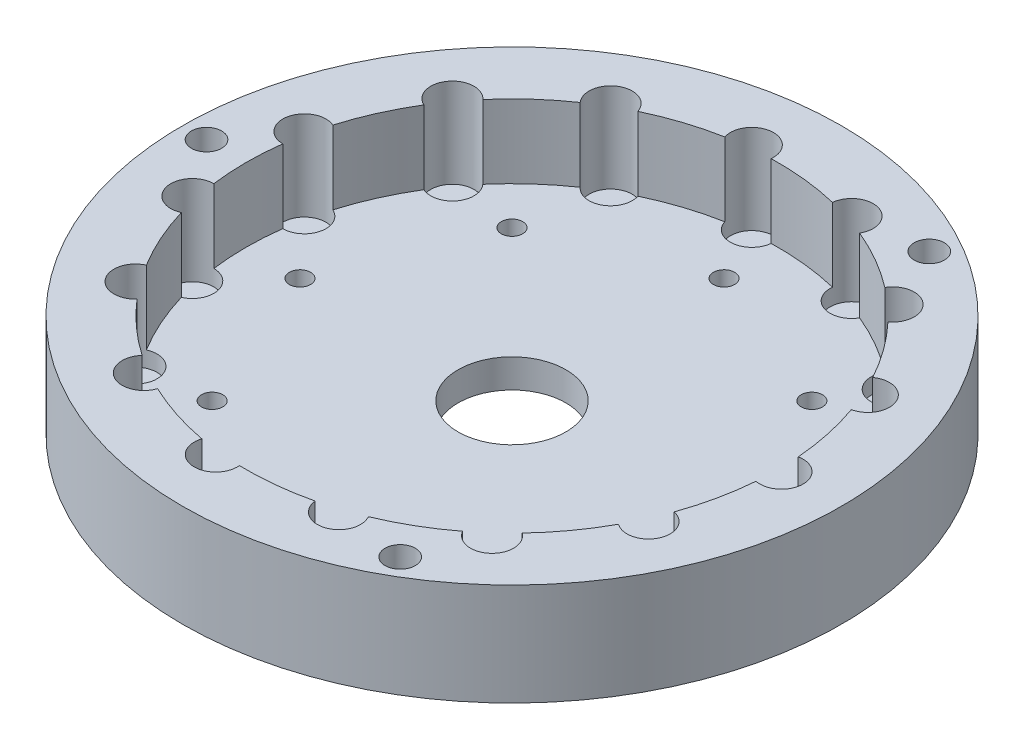
from build123d import *

# Parameters (mm, degrees)
SKETCH1_R           = 45.85
SKETCH1_R_2         = 2.1
SKETCH1_R_3         = 7.5
BOSS_EXTRUDE1_DEPTH = 4
SKETCH1_6_R         = 3
SKETCH1_6_R_2       = 1.48
CUT_EXTRUDE1_DEPTH  = 2.22
BOSS_EXTRUDE2_START = 10.22
SKETCH1_7_R         = 45.85
SKETCH1_7_R_2       = 2.1
BOSS_EXTRUDE2_DEPTH = 10.22


with BuildPart() as part:
    # Sketch1 → Boss-Extrude1 (new body)
    with BuildSketch(Plane(origin=(0, 0, 0), x_dir=(1, 0, 0), z_dir=(0, 1, 0))):
        Circle(SKETCH1_R)
        with Locations((-42.5, 0)):
            Circle(SKETCH1_R_2, mode=Mode.SUBTRACT)
        with Locations((21.25, -36.806079661)):
            Circle(SKETCH1_R_2, mode=Mode.SUBTRACT)
        with Locations((21.25, 36.806079661)):
            Circle(SKETCH1_R_2, mode=Mode.SUBTRACT)
        Circle(SKETCH1_R_3, mode=Mode.SUBTRACT)
    extrude(amount=-BOSS_EXTRUDE1_DEPTH)

    # Sketch1<6> → Cut-Extrude1 (cut)
    with BuildSketch(Plane(origin=(0, 0, 0), x_dir=(1, 0, 0), z_dir=(0, 1, 0))):
        with Locations((37.5, 0)):
            Circle(SKETCH1_6_R)
        with Locations((34.257954662, 15.252624115)):
            Circle(SKETCH1_6_R)
        with Locations((34.257954662, -15.252624115)):
            Circle(SKETCH1_6_R)
        with Locations((25.092397738, 27.867930955)):
            Circle(SKETCH1_6_R)
        with Locations((25.092397738, -27.867930955)):
            Circle(SKETCH1_6_R)
        with Locations((11.588137289, 35.664619361)):
            Circle(SKETCH1_6_R)
        with Locations((11.588137289, -35.664619361)):
            Circle(SKETCH1_6_R)
        with Locations((-3.919817373, 37.294571076)):
            Circle(SKETCH1_6_R)
        with Locations((-3.919817373, -37.294571076)):
            Circle(SKETCH1_6_R)
        with Locations((-18.75, 32.475952642)):
            Circle(SKETCH1_6_R)
        with Locations((-18.75, -32.475952642)):
            Circle(SKETCH1_6_R)
        with Locations((-30.338137289, 22.041946961)):
            Circle(SKETCH1_6_R)
        with Locations((-30.338137289, -22.041946961)):
            Circle(SKETCH1_6_R)
        with Locations((-36.680535028, 7.796688406)):
            Circle(SKETCH1_6_R)
        with Locations((-36.680535028, -7.796688406)):
            Circle(SKETCH1_6_R)
        with Locations((29.5, 0)):
            Circle(SKETCH1_6_R_2)
        with Locations((20.859650045, -20.859650045)):
            Circle(SKETCH1_6_R_2)
        with Locations((0, -29.5)):
            Circle(SKETCH1_6_R_2)
        with Locations((-20.859650045, -20.859650045)):
            Circle(SKETCH1_6_R_2)
        with Locations((-29.5, 0)):
            Circle(SKETCH1_6_R_2)
        with Locations((-20.859650045, 20.859650045)):
            Circle(SKETCH1_6_R_2)
        with Locations((0, 29.5)):
            Circle(SKETCH1_6_R_2)
        with Locations((20.859650045, 20.859650045)):
            Circle(SKETCH1_6_R_2)
    extrude(amount=-CUT_EXTRUDE1_DEPTH, mode=Mode.SUBTRACT)

    # Sketch1<7> → Boss-Extrude2 (add)
    with BuildSketch(Plane(origin=(0, 0, 0), x_dir=(1, 0, 0), z_dir=(0, 1, 0)).offset(BOSS_EXTRUDE2_START)):
        Circle(SKETCH1_7_R)
        with Locations((-42.5, 0)):
            Circle(SKETCH1_7_R_2, mode=Mode.SUBTRACT)
        with Locations((21.25, -36.806079661)):
            Circle(SKETCH1_7_R_2, mode=Mode.SUBTRACT)
        with BuildLine():
            ThreePointArc((36.883333333, 2.935936345), (39.39076704, 2.32916294), (40.5, 0))
            ThreePointArc((40.5, 0), (39.39076704, -2.32916294), (36.883333333, -2.935936345))
            ThreePointArc((36.883333333, -2.935936345), (36.191461227, -7.69273256), (34.888754523, -12.319691873))
            ThreePointArc((34.888754523, -12.319691873), (36.59166411, -13.367471546), (37.257954662, -15.252624115))
            ThreePointArc((37.257954662, -15.252624115), (35.6231437, -17.924001829), (32.500448736, -17.683914497))
            ThreePointArc((32.500448736, -17.683914497), (29.933628792, -21.748054335), (26.861593101, -25.445133446))
            ThreePointArc((26.861593101, -25.445133446), (27.767055295, -26.50917897), (28.092397738, -27.867930955))
            ThreePointArc((28.092397738, -27.867930955), (25.872343464, -30.764771418), (22.497941295, -29.37418318))
            ThreePointArc((22.497941295, -29.37418318), (18.5, -32.04293994), (14.189818202, -34.170880284))
            ThreePointArc((14.189818202, -34.170880284), (14.486847583, -34.891651942), (14.588137289, -35.664619361))
            ThreePointArc((14.588137289, -35.664619361), (11.748752331, -38.660316744), (8.605335417, -35.985388734))
            ThreePointArc((8.605335417, -35.985388734), (3.867553141, -36.797310129), (-0.935505175, -36.988171489))
            ThreePointArc((-0.935505175, -36.988171489), (-0.92374189, -37.141170608), (-0.919817373, -37.294571076))
            ThreePointArc((-0.919817373, -37.294571076), (-4.385552663, -40.258199029), (-6.775211132, -36.37439366))
            ThreePointArc((-6.775211132, -36.37439366), (-11.433628792, -35.189091103), (-15.899071208, -33.409871815))
            ThreePointArc((-15.899071208, -33.409871815), (-20.25, -35.074028853), (-20.984262125, -30.47393547))
            ThreePointArc((-20.984262125, -30.47393547), (-24.757832435, -27.496358543), (-28.113543391, -24.054701786))
            ThreePointArc((-28.113543391, -24.054701786), (-32.765188272, -23.805302718), (-31.564943561, -19.304256991))
            ThreePointArc((-31.564943561, -19.304256991), (-33.801181933, -15.049255794), (-35.466928517, -10.540255288))
            ThreePointArc((-35.466928517, -10.540255288), (-39.61497783, -8.420423478), (-36.687759497, -4.796697105))
            ThreePointArc((-36.687759497, -4.796697105), (-37, 0), (-36.687759497, 4.796697105))
            ThreePointArc((-36.687759497, 4.796697105), (-39.61497783, 8.420423478), (-35.466928517, 10.540255288))
            ThreePointArc((-35.466928517, 10.540255288), (-33.801181933, 15.049255794), (-31.564943561, 19.304256991))
            ThreePointArc((-31.564943561, 19.304256991), (-32.765188272, 23.805302718), (-28.113543391, 24.054701786))
            ThreePointArc((-28.113543391, 24.054701786), (-24.757832435, 27.496358543), (-20.984262125, 30.47393547))
            ThreePointArc((-20.984262125, 30.47393547), (-20.25, 35.074028853), (-15.899071208, 33.409871815))
            ThreePointArc((-15.899071208, 33.409871815), (-11.433628792, 35.189091103), (-6.775211132, 36.37439366))
            ThreePointArc((-6.775211132, 36.37439366), (-4.385552663, 40.258199029), (-0.919817373, 37.294571076))
            ThreePointArc((-0.919817373, 37.294571076), (-0.92374189, 37.141170608), (-0.935505175, 36.988171489))
            ThreePointArc((-0.935505175, 36.988171489), (3.867553141, 36.797310129), (8.605335417, 35.985388734))
            ThreePointArc((8.605335417, 35.985388734), (11.748752331, 38.660316744), (14.588137289, 35.664619361))
            ThreePointArc((14.588137289, 35.664619361), (14.486847583, 34.891651942), (14.189818202, 34.170880284))
            ThreePointArc((14.189818202, 34.170880284), (18.5, 32.04293994), (22.497941295, 29.37418318))
            ThreePointArc((22.497941295, 29.37418318), (25.872343464, 30.764771418), (28.092397738, 27.867930955))
            ThreePointArc((28.092397738, 27.867930955), (27.767055295, 26.50917897), (26.861593101, 25.445133446))
            ThreePointArc((26.861593101, 25.445133446), (29.933628792, 21.748054335), (32.500448736, 17.683914497))
            ThreePointArc((32.500448736, 17.683914497), (35.6231437, 17.924001829), (37.257954662, 15.252624115))
            ThreePointArc((37.257954662, 15.252624115), (36.59166411, 13.367471546), (34.888754523, 12.319691873))
            ThreePointArc((34.888754523, 12.319691873), (36.191461227, 7.69273256), (36.883333333, 2.935936345))
        make_face(mode=Mode.SUBTRACT)
        with Locations((21.25, 36.806079661)):
            Circle(SKETCH1_7_R_2, mode=Mode.SUBTRACT)
    extrude(amount=-BOSS_EXTRUDE2_DEPTH)


solid = part.part
